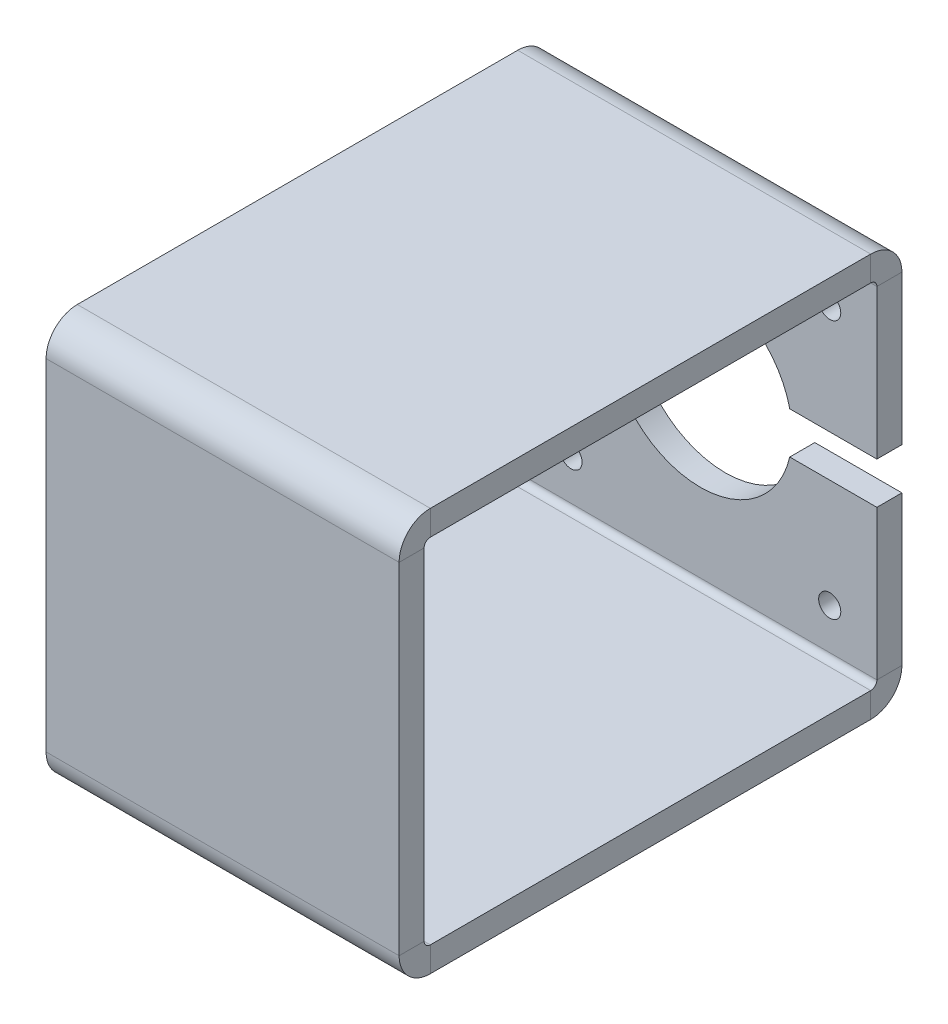
from build123d import *

# Parameters (mm, degrees)
SM_START               = -21.15
SM_BASE_FLANGE_2_DEPTH = 42.3
SKETCH_11_R            = 1.325
SKETCH_11_R_2          = 11
CUT_EXTRUDE_1_DEPTH    = 66.636175239


# Sheet-metal steps are written as plain solids
with BuildPart() as part:
    # Эскиз6 → Базовая кромка2 (new body)
    with BuildSketch(Plane(origin=(0, 0, 0), x_dir=(0, 0, -1), z_dir=(1, 0, 0)).offset(SM_START)):
        with BuildLine():
            Line((57.25, 2.5), (57.25, 20.41))
            ThreePointArc((57.25, 20.41), (57.033259018, 20.933259018), (56.51, 21.15))
            Line((56.51, 21.15), (3.74, 21.15))
            ThreePointArc((3.74, 21.15), (3.216740982, 20.933259018), (3, 20.41))
            Line((3, 20.41), (3, -20.41))
            ThreePointArc((3, -20.41), (3.216740982, -20.933259018), (3.74, -21.15))
            Line((3.74, -21.15), (56.51, -21.15))
            ThreePointArc((56.51, -21.15), (57.033259018, -20.933259018), (57.25, -20.41))
            Line((57.25, -20.41), (57.25, -2.5))
            Line((57.25, -2.5), (60.25, -2.5))
            Line((60.25, -2.5), (60.25, -20.41))
            ThreePointArc((60.25, -20.41), (59.154579362, -23.054579362), (56.51, -24.15))
            Line((56.51, -24.15), (3.74, -24.15))
            ThreePointArc((3.74, -24.15), (1.095420638, -23.054579362), (0, -20.41))
            Line((0, -20.41), (0, 20.41))
            ThreePointArc((0, 20.41), (1.095420638, 23.054579362), (3.74, 24.15))
            Line((3.74, 24.15), (56.51, 24.15))
            ThreePointArc((56.51, 24.15), (59.154579362, 23.054579362), (60.25, 20.41))
            Line((60.25, 20.41), (60.25, 2.5))
            Line((60.25, 2.5), (57.25, 2.5))
        make_face()
    extrude(amount=SM_BASE_FLANGE_2_DEPTH)

    # Эскиз11 → Вырез-Вытянуть1 (cut, through all)
    with BuildSketch(Plane.XY.offset(-57.25)):
        with Locations((-15.5, 15.5)):
            Circle(SKETCH_11_R)
        with Locations((15.5, 15.5)):
            Circle(SKETCH_11_R)
        with Locations((15.5, -15.5)):
            Circle(SKETCH_11_R)
        Circle(SKETCH_11_R_2)
        with Locations((-15.5, -15.5)):
            Circle(SKETCH_11_R)
    extrude(amount=-CUT_EXTRUDE_1_DEPTH, mode=Mode.SUBTRACT)


solid = part.part
